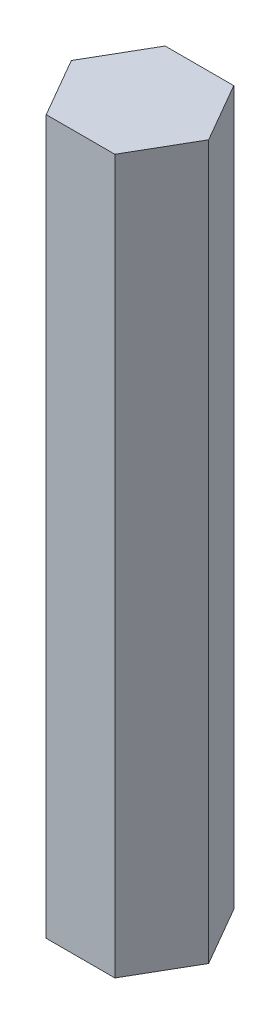
from build123d import *

# Parameters (mm, degrees)
BOSS_EXTRUDE1_DEPTH = 76.2


with BuildPart() as part:
    # Sketch1 → Boss-Extrude1 (new body)
    with BuildSketch(Plane(origin=(0, 0, 0), x_dir=(1, 0, 0), z_dir=(0, 1, 0))):
        Polygon((7.332348419, 0), (3.666174209, 6.35), (-3.666174209, 6.35), (-7.332348419, 0), (-3.666174209, -6.35), (3.666174209, -6.35), align=None)
    extrude(amount=BOSS_EXTRUDE1_DEPTH)


solid = part.part
